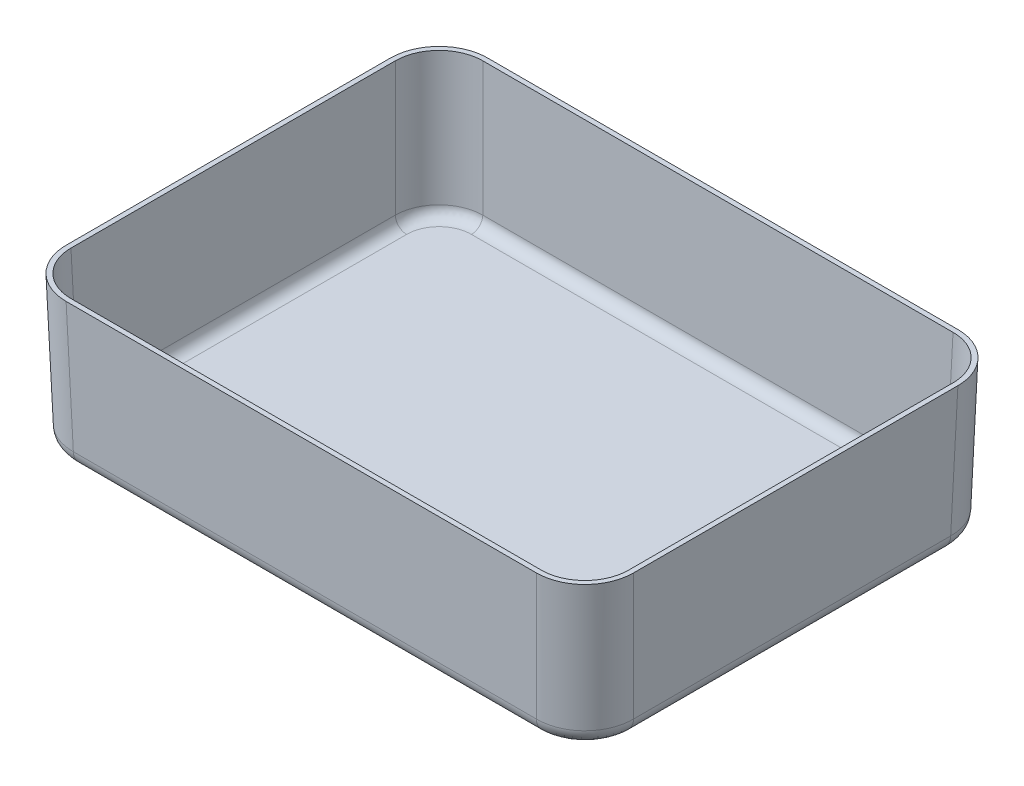
from build123d import *

# Parameters (mm, degrees)
SKETCH_1_W      = 350
SKETCH_1_H      = 260
EXTRUDE_1_DEPTH = 90
DRAFT_3_ANGLE   = -1.591
FILLET_1_R      = 30
FILLET_3_R      = 10
SHELL_1_T       = -3


with BuildPart() as part:
    # 草圖1 → 填料-伸長1 (new body)
    with BuildSketch(Plane(origin=(0, 0, 0), x_dir=(1, 0, 0), z_dir=(0, 1, 0))):
        Rectangle(SKETCH_1_W, SKETCH_1_H)
    extrude(amount=EXTRUDE_1_DEPTH)

    # 拔模3
    draft_3_faces = [part.faces().sort_by_distance(p)[0] for p in [
        (-175, 45, 0),
        (0, 45, -130),
        (175, 45, 0),
        (0, 45, 130),
    ]]
    draft(draft_3_faces, Plane.ZX.offset(90), DRAFT_3_ANGLE)

    # 圓角1
    fillet_1_edges = [part.edges().sort_by_distance(p)[0] for p in [
        (173.750110254, 45, 128.750110254),
        (-173.750110254, 45, 128.750110254),
        (-173.750110254, 45, -128.750110254),
        (173.750110254, 45, -128.750110254),
    ]]
    fillet(fillet_1_edges, radius=FILLET_1_R)

    # 圓角3
    fillet_3_edges = [part.edges().sort_by_distance(p)[0] for p in [
        (-163.718213159, 0, 118.718213159),
        (-172.500220507, 0, 0),
        (-163.718213159, 0, -118.718213159),
        (0, 0, -127.500220507),
        (163.718213159, 0, -118.718213159),
        (172.500220507, 0, 0),
        (163.718213159, 0, 118.718213159),
        (0, 0, 127.500220507),
    ]]
    fillet(fillet_3_edges, radius=FILLET_3_R)

    # 薄殼1
    shell_1_openings = [part.faces().sort_by_distance(p)[0] for p in [
        (0, 90, 0),
    ]]
    offset(amount=SHELL_1_T, openings=shell_1_openings, kind=Kind.INTERSECTION)


solid = part.part
